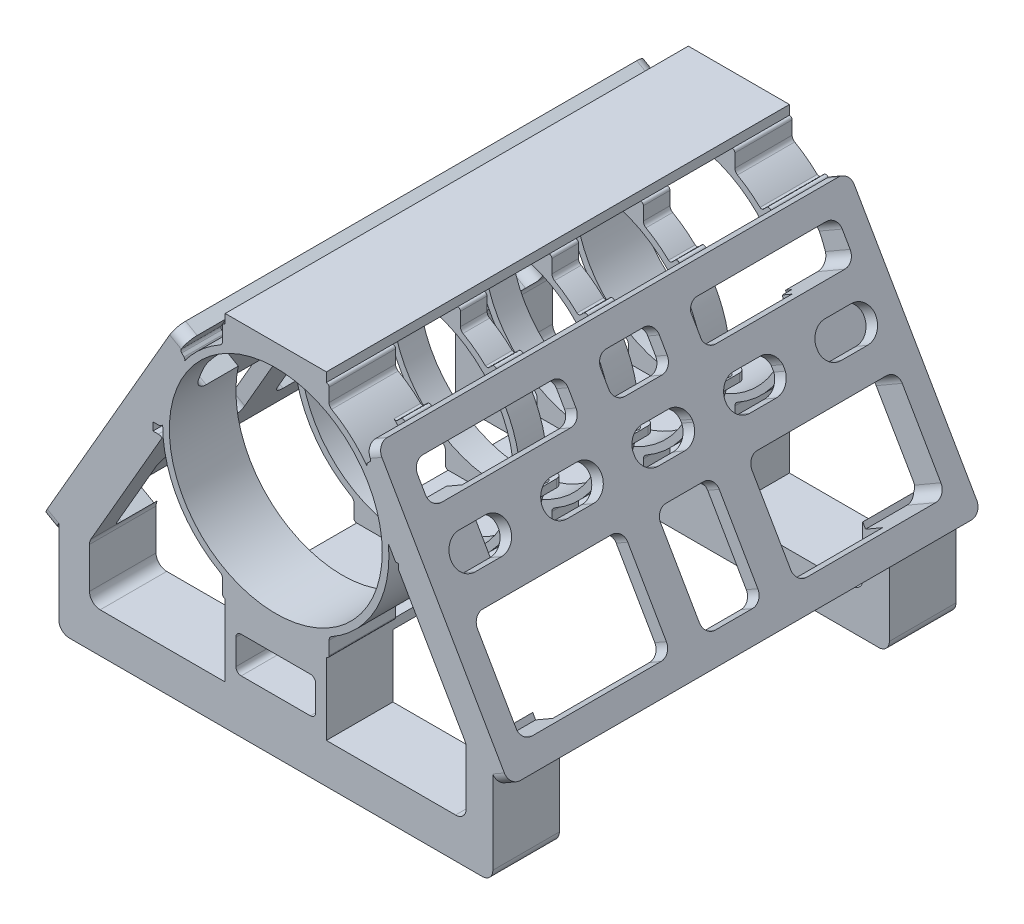
from build123d import *

# Parameters (mm, degrees)
SKETCH1_R               = 50.8
BOSS_EXTRUDE1_DEPTH     = 12.7
SKETCH2_R               = 1.905
CUT_EXTRUDE1_DEPTH      = 12.7
SKETCH4_R               = 50.8
BOSS_EXTRUDE3_DEPTH     = 12.7
SKETCH5_R               = 50.8
BOSS_EXTRUDE4_DEPTH     = 12.7
SKETCH6_R               = 50.8
BOSS_EXTRUDE5_DEPTH     = 12.7
SKETCH7_R               = 50.8
BOSS_EXTRUDE6_DEPTH     = 12.7
SKETCH8_R               = 1.905
CUT_EXTRUDE2_DEPTH      = 12.7
CUT_EXTRUDE3_DEPTH      = 12.7
SKETCH12_W              = 48.26
SKETCH12_H              = 187.2996
BOSS_EXTRUDE7_DEPTH     = 4.445
BOSS_EXTRUDE26_DEPTH    = 6.35
CUT_EXTRUDE4_DEPTH      = 6.35
BOSS_EXTRUDE28_DEPTH    = 12.7
BOSS_EXTRUDE29_DEPTH    = 12.7
BOSS_EXTRUDE30_DEPTH    = 12.7
BOSS_EXTRUDE31_DEPTH    = 12.7
SKETCH22_W              = 48.26
SKETCH22_H              = 187.2996
BOSS_EXTRUDE34_DEPTH    = 4.445
BOSS_EXTRUDE35_DEPTH    = 31.75
LPATTERN1_COUNT         = 2
LPATTERN1_PITCH         = 189.2046
BOSS_EXTRUDE36_START    = 19.05
SKETCH25_R              = 50.8
BOSS_EXTRUDE36_DEPTH    = 19.05
BOSS_EXTRUDE38_START    = 19.05
BOSS_EXTRUDE38_DEPTH    = 19.05
BOSS_EXTRUDE39_START    = 19.05
BOSS_EXTRUDE39_DEPTH    = 19.05
BOSS_EXTRUDE40_DEPTH    = 19.05
SKETCH32_R              = 50.8
CUT_EXTRUDE5_DEPTH      = 275.572714835
CUT_EXTRUDE7_DEPTH      = 275.572714835
CUT_EXTRUDE7_DEPTH_BACK = 4.445
CUT_EXTRUDE11_START     = -15.748
CUT_EXTRUDE11_DEPTH     = 9.398
CUT_EXTRUDE12_START     = -19.05
CUT_EXTRUDE12_OUTLINE_W = 12.7
CUT_EXTRUDE12_OUTLINE_H = 17.667421193
CUT_EXTRUDE12_DEPTH     = 9.632250328


# Read off the part's stored shape, not the designer's step: Cut-Extrude11, Cut-Extrude12
with BuildPart() as part:
    # Sketch1 → Boss-Extrude1 (new body)
    with BuildSketch(Plane.XY):
        with BuildLine():
            ThreePointArc((-24.13, 56.74467868), (-25.028025612, 56.372704292), (-25.4, 55.47467868))
            Line((-25.4, 55.47467868), (-25.4, 49.12467868))
            ThreePointArc((-25.4, 49.12467868), (-25.730999026, 47.870918456), (-26.637728109, 46.9439247))
            ThreePointArc((-26.637728109, 46.9439247), (-26.68425638, 46.916804598), (-26.731349183, 46.890677068))
            ThreePointArc((-26.731349183, 46.890677068), (-32.303638997, 43.240901153), (-37.383925434, 38.932540941))
            ThreePointArc((-37.383925434, 38.932540941), (-38.2373613, 38.678752562), (-39.047695886, 39.047695886))
            Line((-39.047695886, 39.047695886), (-40.5878612, 40.5878612))
            ThreePointArc((-40.5878612, 40.5878612), (-41.651655076, 40.948970562), (-42.585739075, 40.324835588))
            Line((-42.585739075, 40.324835588), (-45.080938326, 36.00302371))
            ThreePointArc((-45.080938326, 36.00302371), (-45.240221037, 35.202255446), (-44.879111675, 34.469998098))
            Line((-44.879111675, 34.469998098), (-43.788893028, 33.379779451))
            ThreePointArc((-43.788893028, 33.379779451), (-43.419949704, 32.569444865), (-43.673738083, 31.716008999))
            ThreePointArc((-43.673738083, 31.716008999), (-51.295032598, 16.796435806), (-53.974380344, 0.258633957))
            ThreePointArc((-53.974380344, 0.258633957), (-54.882706609, -0.539859536), (-56.057333721, -0.827782462))
            Line((-56.057333721, -0.827782462), (-61.157902992, -0.827782462))
            Line((-61.157902992, -0.827782462), (-61.157902992, -4.637782462))
            Line((-61.157902992, -4.637782462), (-56.057333721, -4.637782462))
            ThreePointArc((-56.057333721, -4.637782462), (-54.379209216, -5.271084231), (-53.537902992, -6.855185497))
            ThreePointArc((-53.537902992, -6.855185497), (0, -53.975), (53.537902992, -6.855185497))
            ThreePointArc((53.537902992, -6.855185497), (54.379209216, -5.271084231), (56.057333721, -4.637782462))
            Line((56.057333721, -4.637782462), (61.157902992, -4.637782462))
            Line((61.157902992, -4.637782462), (61.157902992, -0.827782462))
            Line((61.157902992, -0.827782462), (56.057333721, -0.827782462))
            ThreePointArc((56.057333721, -0.827782462), (54.882706609, -0.539859536), (53.974380344, 0.258633957))
            ThreePointArc((53.974380344, 0.258633957), (51.295032598, 16.796435806), (43.673738083, 31.716008999))
            ThreePointArc((43.673738083, 31.716008999), (43.419949704, 32.569444865), (43.788893028, 33.379779451))
            Line((43.788893028, 33.379779451), (44.879111675, 34.469998098))
            ThreePointArc((44.879111675, 34.469998098), (45.240221037, 35.202255446), (45.080938326, 36.00302371))
            Line((45.080938326, 36.00302371), (42.585739075, 40.324835588))
            ThreePointArc((42.585739075, 40.324835588), (41.651655076, 40.948970562), (40.5878612, 40.5878612))
            Line((40.5878612, 40.5878612), (39.047695886, 39.047695886))
            ThreePointArc((39.047695886, 39.047695886), (38.2373613, 38.678752562), (37.383925434, 38.932540941))
            ThreePointArc((37.383925434, 38.932540941), (32.260480437, 43.273109745), (26.637728109, 46.9439247))
            ThreePointArc((26.637728109, 46.9439247), (25.730999026, 47.870918456), (25.4, 49.12467868))
            Line((25.4, 49.12467868), (25.4, 55.47467868))
            ThreePointArc((25.4, 55.47467868), (25.028025612, 56.372704292), (24.13, 56.74467868))
            Line((24.13, 56.74467868), (-24.13, 56.74467868))
        make_face()
        Circle(SKETCH1_R, mode=Mode.SUBTRACT)
    extrude(amount=-BOSS_EXTRUDE1_DEPTH)

    # Sketch2 → Cut-Extrude1 (cut)
    with BuildSketch(Plane(origin=(0, -0.827782462, 0), x_dir=(1, 0, 0), z_dir=(0, 1, 0))):
        with Locations(Location((-58.607618357, 6.35, 0), (0, 0, 180))):
            Circle(SKETCH2_R)
        with Locations(Location((58.607618357, 6.35, 0), (0, 0, 180))):
            Circle(SKETCH2_R)
    extrude(amount=-CUT_EXTRUDE1_DEPTH, mode=Mode.SUBTRACT)


with BuildPart() as body_2:
    # Sketch4 → Boss-Extrude3 (new body)
    with BuildSketch(Plane.XY.offset(-43.6499)):
        with BuildLine():
            ThreePointArc((-24.13, 56.74467868), (-25.028025612, 56.372704292), (-25.4, 55.47467868))
            Line((-25.4, 55.47467868), (-25.4, 49.12467868))
            ThreePointArc((-25.4, 49.12467868), (-25.730999026, 47.870918456), (-26.637728109, 46.9439247))
            ThreePointArc((-26.637728109, 46.9439247), (-26.68425638, 46.916804598), (-26.731349183, 46.890677068))
            ThreePointArc((-26.731349183, 46.890677068), (-32.303638997, 43.240901153), (-37.383925434, 38.932540941))
            ThreePointArc((-37.383925434, 38.932540941), (-38.2373613, 38.678752562), (-39.047695886, 39.047695886))
            Line((-39.047695886, 39.047695886), (-40.5878612, 40.5878612))
            ThreePointArc((-40.5878612, 40.5878612), (-41.651655076, 40.948970562), (-42.585739075, 40.324835588))
            Line((-42.585739075, 40.324835588), (-45.080938326, 36.00302371))
            ThreePointArc((-45.080938326, 36.00302371), (-45.240221037, 35.202255446), (-44.879111675, 34.469998098))
            Line((-44.879111675, 34.469998098), (-43.788893028, 33.379779451))
            ThreePointArc((-43.788893028, 33.379779451), (-43.419949704, 32.569444865), (-43.673738083, 31.716008999))
            ThreePointArc((-43.673738083, 31.716008999), (-51.295032598, 16.796435806), (-53.974380344, 0.258633957))
            ThreePointArc((-53.974380344, 0.258633957), (-54.882706609, -0.539859536), (-56.057333721, -0.827782462))
            Line((-56.057333721, -0.827782462), (-61.157902992, -0.827782462))
            Line((-61.157902992, -0.827782462), (-61.157902992, -4.637782462))
            Line((-61.157902992, -4.637782462), (-56.057333721, -4.637782462))
            ThreePointArc((-56.057333721, -4.637782462), (-54.379209216, -5.271084231), (-53.537902992, -6.855185497))
            ThreePointArc((-53.537902992, -6.855185497), (0, -53.975), (53.537902992, -6.855185497))
            ThreePointArc((53.537902992, -6.855185497), (54.379209216, -5.271084231), (56.057333721, -4.637782462))
            Line((56.057333721, -4.637782462), (61.157902992, -4.637782462))
            Line((61.157902992, -4.637782462), (61.157902992, -0.827782462))
            Line((61.157902992, -0.827782462), (56.057333721, -0.827782462))
            ThreePointArc((56.057333721, -0.827782462), (54.882706609, -0.539859536), (53.974380344, 0.258633957))
            ThreePointArc((53.974380344, 0.258633957), (51.295032598, 16.796435806), (43.673738083, 31.716008999))
            ThreePointArc((43.673738083, 31.716008999), (43.419949704, 32.569444865), (43.788893028, 33.379779451))
            Line((43.788893028, 33.379779451), (44.879111675, 34.469998098))
            ThreePointArc((44.879111675, 34.469998098), (45.240221037, 35.202255446), (45.080938326, 36.00302371))
            Line((45.080938326, 36.00302371), (42.585739075, 40.324835588))
            ThreePointArc((42.585739075, 40.324835588), (41.651655076, 40.948970562), (40.5878612, 40.5878612))
            Line((40.5878612, 40.5878612), (39.047695886, 39.047695886))
            ThreePointArc((39.047695886, 39.047695886), (38.2373613, 38.678752562), (37.383925434, 38.932540941))
            ThreePointArc((37.383925434, 38.932540941), (32.260480437, 43.273109745), (26.637728109, 46.9439247))
            ThreePointArc((26.637728109, 46.9439247), (25.730999026, 47.870918456), (25.4, 49.12467868))
            Line((25.4, 49.12467868), (25.4, 55.47467868))
            ThreePointArc((25.4, 55.47467868), (25.028025612, 56.372704292), (24.13, 56.74467868))
            Line((24.13, 56.74467868), (-24.13, 56.74467868))
        make_face()
        Circle(SKETCH4_R, mode=Mode.SUBTRACT)
    extrude(amount=-BOSS_EXTRUDE3_DEPTH)


with BuildPart() as body_3:
    # Sketch5 → Boss-Extrude4 (new body)
    with BuildSketch(Plane.XY.offset(-87.2998)):
        with BuildLine():
            ThreePointArc((-24.13, 56.74467868), (-25.028025612, 56.372704292), (-25.4, 55.47467868))
            Line((-25.4, 55.47467868), (-25.4, 49.12467868))
            ThreePointArc((-25.4, 49.12467868), (-25.730999026, 47.870918456), (-26.637728109, 46.9439247))
            ThreePointArc((-26.637728109, 46.9439247), (-26.68425638, 46.916804598), (-26.731349183, 46.890677068))
            ThreePointArc((-26.731349183, 46.890677068), (-32.303638997, 43.240901153), (-37.383925434, 38.932540941))
            ThreePointArc((-37.383925434, 38.932540941), (-38.2373613, 38.678752562), (-39.047695886, 39.047695886))
            Line((-39.047695886, 39.047695886), (-40.5878612, 40.5878612))
            ThreePointArc((-40.5878612, 40.5878612), (-41.651655076, 40.948970562), (-42.585739075, 40.324835588))
            Line((-42.585739075, 40.324835588), (-45.080938326, 36.00302371))
            ThreePointArc((-45.080938326, 36.00302371), (-45.240221037, 35.202255446), (-44.879111675, 34.469998098))
            Line((-44.879111675, 34.469998098), (-43.788893028, 33.379779451))
            ThreePointArc((-43.788893028, 33.379779451), (-43.419949704, 32.569444865), (-43.673738083, 31.716008999))
            ThreePointArc((-43.673738083, 31.716008999), (-51.295032598, 16.796435806), (-53.974380344, 0.258633957))
            ThreePointArc((-53.974380344, 0.258633957), (-54.882706609, -0.539859536), (-56.057333721, -0.827782462))
            Line((-56.057333721, -0.827782462), (-61.157902992, -0.827782462))
            Line((-61.157902992, -0.827782462), (-61.157902992, -4.637782462))
            Line((-61.157902992, -4.637782462), (-56.057333721, -4.637782462))
            ThreePointArc((-56.057333721, -4.637782462), (-54.379209216, -5.271084231), (-53.537902992, -6.855185497))
            ThreePointArc((-53.537902992, -6.855185497), (0, -53.975), (53.537902992, -6.855185497))
            ThreePointArc((53.537902992, -6.855185497), (54.379209216, -5.271084231), (56.057333721, -4.637782462))
            Line((56.057333721, -4.637782462), (61.157902992, -4.637782462))
            Line((61.157902992, -4.637782462), (61.157902992, -0.827782462))
            Line((61.157902992, -0.827782462), (56.057333721, -0.827782462))
            ThreePointArc((56.057333721, -0.827782462), (54.882706609, -0.539859536), (53.974380344, 0.258633957))
            ThreePointArc((53.974380344, 0.258633957), (51.295032598, 16.796435806), (43.673738083, 31.716008999))
            ThreePointArc((43.673738083, 31.716008999), (43.419949704, 32.569444865), (43.788893028, 33.379779451))
            Line((43.788893028, 33.379779451), (44.879111675, 34.469998098))
            ThreePointArc((44.879111675, 34.469998098), (45.240221037, 35.202255446), (45.080938326, 36.00302371))
            Line((45.080938326, 36.00302371), (42.585739075, 40.324835588))
            ThreePointArc((42.585739075, 40.324835588), (41.651655076, 40.948970562), (40.5878612, 40.5878612))
            Line((40.5878612, 40.5878612), (39.047695886, 39.047695886))
            ThreePointArc((39.047695886, 39.047695886), (38.2373613, 38.678752562), (37.383925434, 38.932540941))
            ThreePointArc((37.383925434, 38.932540941), (32.260480437, 43.273109745), (26.637728109, 46.9439247))
            ThreePointArc((26.637728109, 46.9439247), (25.730999026, 47.870918456), (25.4, 49.12467868))
            Line((25.4, 49.12467868), (25.4, 55.47467868))
            ThreePointArc((25.4, 55.47467868), (25.028025612, 56.372704292), (24.13, 56.74467868))
            Line((24.13, 56.74467868), (-24.13, 56.74467868))
        make_face()
        Circle(SKETCH5_R, mode=Mode.SUBTRACT)
    extrude(amount=-BOSS_EXTRUDE4_DEPTH)


with BuildPart() as body_4:
    # Sketch6 → Boss-Extrude5 (new body)
    with BuildSketch(Plane.XY.offset(-130.9497)):
        with BuildLine():
            ThreePointArc((-24.13, 56.74467868), (-25.028025612, 56.372704292), (-25.4, 55.47467868))
            Line((-25.4, 55.47467868), (-25.4, 49.12467868))
            ThreePointArc((-25.4, 49.12467868), (-25.730999026, 47.870918456), (-26.637728109, 46.9439247))
            ThreePointArc((-26.637728109, 46.9439247), (-26.68425638, 46.916804598), (-26.731349183, 46.890677068))
            ThreePointArc((-26.731349183, 46.890677068), (-32.303638997, 43.240901153), (-37.383925434, 38.932540941))
            ThreePointArc((-37.383925434, 38.932540941), (-38.2373613, 38.678752562), (-39.047695886, 39.047695886))
            Line((-39.047695886, 39.047695886), (-40.5878612, 40.5878612))
            ThreePointArc((-40.5878612, 40.5878612), (-41.651655076, 40.948970562), (-42.585739075, 40.324835588))
            Line((-42.585739075, 40.324835588), (-45.080938326, 36.00302371))
            ThreePointArc((-45.080938326, 36.00302371), (-45.240221037, 35.202255446), (-44.879111675, 34.469998098))
            Line((-44.879111675, 34.469998098), (-43.788893028, 33.379779451))
            ThreePointArc((-43.788893028, 33.379779451), (-43.419949704, 32.569444865), (-43.673738083, 31.716008999))
            ThreePointArc((-43.673738083, 31.716008999), (-51.295032598, 16.796435806), (-53.974380344, 0.258633957))
            ThreePointArc((-53.974380344, 0.258633957), (-54.882706609, -0.539859536), (-56.057333721, -0.827782462))
            Line((-56.057333721, -0.827782462), (-61.157902992, -0.827782462))
            Line((-61.157902992, -0.827782462), (-61.157902992, -4.637782462))
            Line((-61.157902992, -4.637782462), (-56.057333721, -4.637782462))
            ThreePointArc((-56.057333721, -4.637782462), (-54.379209216, -5.271084231), (-53.537902992, -6.855185497))
            ThreePointArc((-53.537902992, -6.855185497), (0, -53.975), (53.537902992, -6.855185497))
            ThreePointArc((53.537902992, -6.855185497), (54.379209216, -5.271084231), (56.057333721, -4.637782462))
            Line((56.057333721, -4.637782462), (61.157902992, -4.637782462))
            Line((61.157902992, -4.637782462), (61.157902992, -0.827782462))
            Line((61.157902992, -0.827782462), (56.057333721, -0.827782462))
            ThreePointArc((56.057333721, -0.827782462), (54.882706609, -0.539859536), (53.974380344, 0.258633957))
            ThreePointArc((53.974380344, 0.258633957), (51.295032598, 16.796435806), (43.673738083, 31.716008999))
            ThreePointArc((43.673738083, 31.716008999), (43.419949704, 32.569444865), (43.788893028, 33.379779451))
            Line((43.788893028, 33.379779451), (44.879111675, 34.469998098))
            ThreePointArc((44.879111675, 34.469998098), (45.240221037, 35.202255446), (45.080938326, 36.00302371))
            Line((45.080938326, 36.00302371), (42.585739075, 40.324835588))
            ThreePointArc((42.585739075, 40.324835588), (41.651655076, 40.948970562), (40.5878612, 40.5878612))
            Line((40.5878612, 40.5878612), (39.047695886, 39.047695886))
            ThreePointArc((39.047695886, 39.047695886), (38.2373613, 38.678752562), (37.383925434, 38.932540941))
            ThreePointArc((37.383925434, 38.932540941), (32.260480437, 43.273109745), (26.637728109, 46.9439247))
            ThreePointArc((26.637728109, 46.9439247), (25.730999026, 47.870918456), (25.4, 49.12467868))
            Line((25.4, 49.12467868), (25.4, 55.47467868))
            ThreePointArc((25.4, 55.47467868), (25.028025612, 56.372704292), (24.13, 56.74467868))
            Line((24.13, 56.74467868), (-24.13, 56.74467868))
        make_face()
        Circle(SKETCH6_R, mode=Mode.SUBTRACT)
    extrude(amount=-BOSS_EXTRUDE5_DEPTH)


with BuildPart() as body_5:
    # Sketch7 → Boss-Extrude6 (new body)
    with BuildSketch(Plane.XY.offset(-174.5996)):
        with BuildLine():
            ThreePointArc((-24.13, 56.74467868), (-25.028025612, 56.372704292), (-25.4, 55.47467868))
            Line((-25.4, 55.47467868), (-25.4, 49.12467868))
            ThreePointArc((-25.4, 49.12467868), (-25.75807733, 47.824365847), (-26.731349183, 46.890677068))
            ThreePointArc((-26.731349183, 46.890677068), (-32.303638997, 43.240901153), (-37.383925434, 38.932540941))
            ThreePointArc((-37.383925434, 38.932540941), (-38.2373613, 38.678752562), (-39.047695886, 39.047695886))
            Line((-39.047695886, 39.047695886), (-40.5878612, 40.5878612))
            ThreePointArc((-40.5878612, 40.5878612), (-41.651655076, 40.948970562), (-42.585739075, 40.324835588))
            Line((-42.585739075, 40.324835588), (-45.080938326, 36.00302371))
            ThreePointArc((-45.080938326, 36.00302371), (-45.240221037, 35.202255446), (-44.879111675, 34.469998098))
            Line((-44.879111675, 34.469998098), (-43.788893028, 33.379779451))
            ThreePointArc((-43.788893028, 33.379779451), (-43.419949704, 32.569444865), (-43.673738083, 31.716008999))
            ThreePointArc((-43.673738083, 31.716008999), (-51.295032598, 16.796435806), (-53.974380344, 0.258633957))
            ThreePointArc((-53.974380344, 0.258633957), (-54.882706609, -0.539859536), (-56.057333721, -0.827782462))
            Line((-56.057333721, -0.827782462), (-61.157902992, -0.827782462))
            Line((-61.157902992, -0.827782462), (-61.157902992, -4.637782462))
            Line((-61.157902992, -4.637782462), (-56.057333721, -4.637782462))
            ThreePointArc((-56.057333721, -4.637782462), (-54.379209216, -5.271084231), (-53.537902992, -6.855185497))
            ThreePointArc((-53.537902992, -6.855185497), (-44.849730852, -30.030022769), (-26.731349183, -46.890677068))
            ThreePointArc((-26.731349183, -46.890677068), (-25.75807733, -47.824365847), (-25.4, -49.12467868))
            Line((-25.4, -49.12467868), (-25.4, -55.47467868))
            ThreePointArc((-25.4, -55.47467868), (-25.028025612, -56.372704292), (-24.13, -56.74467868))
            Line((-24.13, -56.74467868), (24.13, -56.74467868))
            ThreePointArc((24.13, -56.74467868), (25.028025612, -56.372704292), (25.4, -55.47467868))
            Line((25.4, -55.47467868), (25.4, -49.12467868))
            ThreePointArc((25.4, -49.12467868), (25.730999026, -47.870918456), (26.637728109, -46.9439247))
            ThreePointArc((26.637728109, -46.9439247), (44.819746857, -30.074755472), (53.537902992, -6.855185497))
            ThreePointArc((53.537902992, -6.855185497), (54.379209216, -5.271084231), (56.057333721, -4.637782462))
            Line((56.057333721, -4.637782462), (61.157902992, -4.637782462))
            Line((61.157902992, -4.637782462), (61.157902992, -0.827782462))
            Line((61.157902992, -0.827782462), (56.057333721, -0.827782462))
            ThreePointArc((56.057333721, -0.827782462), (54.882706609, -0.539859536), (53.974380344, 0.258633957))
            ThreePointArc((53.974380344, 0.258633957), (51.295032598, 16.796435806), (43.673738083, 31.716008999))
            ThreePointArc((43.673738083, 31.716008999), (43.419949704, 32.569444865), (43.788893028, 33.379779451))
            Line((43.788893028, 33.379779451), (44.879111675, 34.469998098))
            ThreePointArc((44.879111675, 34.469998098), (45.240221037, 35.202255446), (45.080938326, 36.00302371))
            Line((45.080938326, 36.00302371), (42.585739075, 40.324835588))
            ThreePointArc((42.585739075, 40.324835588), (41.651655076, 40.948970562), (40.5878612, 40.5878612))
            Line((40.5878612, 40.5878612), (39.047695886, 39.047695886))
            ThreePointArc((39.047695886, 39.047695886), (38.2373613, 38.678752562), (37.383925434, 38.932540941))
            ThreePointArc((37.383925434, 38.932540941), (32.260480437, 43.273109745), (26.637728109, 46.9439247))
            ThreePointArc((26.637728109, 46.9439247), (25.730999026, 47.870918456), (25.4, 49.12467868))
            Line((25.4, 49.12467868), (25.4, 55.47467868))
            ThreePointArc((25.4, 55.47467868), (25.028025612, 56.372704292), (24.13, 56.74467868))
            Line((24.13, 56.74467868), (-24.13, 56.74467868))
        make_face()
        Circle(SKETCH7_R, mode=Mode.SUBTRACT)
    extrude(amount=-BOSS_EXTRUDE6_DEPTH)


with BuildPart() as cut_extrude2_tool:
    # Sketch8 → Cut-Extrude2 (new body)
    with BuildSketch(Plane(origin=(0, -0.827782462, 0), x_dir=(1, 0, 0), z_dir=(0, 1, 0))):
        with Locations(Location((-58.607618357, 49.9999, 0), (0, 0, 180))):
            Circle(SKETCH8_R)
        with Locations(Location((58.607618357, 49.9999, 0), (0, 0, 180))):
            Circle(SKETCH8_R)
        with Locations(Location((58.607618357, 93.6498, 0), (0, 0, 180))):
            Circle(SKETCH8_R)
        with Locations(Location((-58.607618357, 93.6498, 0), (0, 0, 180))):
            Circle(SKETCH8_R)
        with Locations(Location((58.607618357, 137.2997, 0), (0, 0, 180))):
            Circle(SKETCH8_R)
        with Locations(Location((-58.607618357, 137.2997, 0), (0, 0, 180))):
            Circle(SKETCH8_R)
        with Locations(Location((58.607618357, 180.9496, 0), (0, 0, 180))):
            Circle(SKETCH8_R)
        with Locations(Location((-58.607618357, 180.9496, 0), (0, 0, 180))):
            Circle(SKETCH8_R)
    extrude(amount=-CUT_EXTRUDE2_DEPTH)


with BuildPart() as body_2_1:
    add(body_2.part)

    # Cut-Extrude2: cut by cut_extrude2_tool
    add(cut_extrude2_tool.part, mode=Mode.SUBTRACT)


with BuildPart() as body_3_1:
    add(body_3.part)

    # Cut-Extrude2: cut by cut_extrude2_tool
    add(cut_extrude2_tool.part, mode=Mode.SUBTRACT)


with BuildPart() as body_4_1:
    add(body_4.part)

    # Cut-Extrude2: cut by cut_extrude2_tool
    add(cut_extrude2_tool.part, mode=Mode.SUBTRACT)


with BuildPart() as body_5_1:
    add(body_5.part)

    # Cut-Extrude2: cut by cut_extrude2_tool
    add(cut_extrude2_tool.part, mode=Mode.SUBTRACT)


with BuildPart() as cut_extrude3_tool:
    # Sketch11 → Cut-Extrude3 (new body)
    with BuildSketch(Plane(origin=(0, -0.827782462, 0), x_dir=(1, 0, 0), z_dir=(0, 1, 0))):
        with BuildLine():
            Line((-58.617902992, 0), (-61.157902992, 0))
            Line((-61.157902992, 0), (-61.157902992, 2.54))
            ThreePointArc((-61.157902992, 2.54), (-60.413954216, 0.743948776), (-58.617902992, 0))
        make_face()
        with BuildLine():
            Line((-58.617902992, 12.7), (-61.157902992, 12.7))
            Line((-61.157902992, 12.7), (-61.157902992, 10.16))
            ThreePointArc((-61.157902992, 10.16), (-60.413954216, 11.956051224), (-58.617902992, 12.7))
        make_face()
        with BuildLine():
            Line((58.617902992, 12.7), (61.157902992, 12.7))
            Line((61.157902992, 12.7), (61.157902992, 10.16))
            ThreePointArc((61.157902992, 10.16), (60.413954216, 11.956051224), (58.617902992, 12.7))
        make_face()
        with BuildLine():
            Line((61.157902992, 0), (61.157902992, 2.54))
            ThreePointArc((61.157902992, 2.54), (60.413954216, 0.743948776), (58.617902992, 0))
            Line((58.617902992, 0), (61.157902992, 0))
        make_face()
        with BuildLine():
            Line((58.617902992, 43.6499), (61.157902992, 43.6499))
            Line((61.157902992, 43.6499), (61.157902992, 46.1899))
            ThreePointArc((61.157902992, 46.1899), (60.413954216, 44.393848776), (58.617902992, 43.6499))
        make_face()
        with BuildLine():
            Line((58.617902992, 56.3499), (61.157902992, 56.3499))
            Line((61.157902992, 56.3499), (61.157902992, 53.8099))
            ThreePointArc((61.157902992, 53.8099), (60.413954216, 55.605951224), (58.617902992, 56.3499))
        make_face()
        with BuildLine():
            Line((58.617902992, 87.2998), (61.157902992, 87.2998))
            Line((61.157902992, 87.2998), (61.157902992, 89.8398))
            ThreePointArc((61.157902992, 89.8398), (60.413954216, 88.043748776), (58.617902992, 87.2998))
        make_face()
        with BuildLine():
            Line((61.157902992, 99.9998), (61.157902992, 97.4598))
            ThreePointArc((61.157902992, 97.4598), (60.413954216, 99.255851224), (58.617902992, 99.9998))
            Line((58.617902992, 99.9998), (61.157902992, 99.9998))
        make_face()
        with BuildLine():
            Line((61.157902992, 130.9497), (61.157902992, 133.4897))
            ThreePointArc((61.157902992, 133.4897), (60.413954216, 131.693648776), (58.617902992, 130.9497))
            Line((58.617902992, 130.9497), (61.157902992, 130.9497))
        make_face()
        with BuildLine():
            Line((61.157902992, 143.6497), (61.157902992, 141.1097))
            ThreePointArc((61.157902992, 141.1097), (60.413954216, 142.905751224), (58.617902992, 143.6497))
            Line((58.617902992, 143.6497), (61.157902992, 143.6497))
        make_face()
        with BuildLine():
            Line((58.617902992, 174.5996), (61.157902992, 174.5996))
            Line((61.157902992, 174.5996), (61.157902992, 177.1396))
            ThreePointArc((61.157902992, 177.1396), (60.413954216, 175.343548776), (58.617902992, 174.5996))
        make_face()
        with BuildLine():
            Line((61.157902992, 187.2996), (58.617902992, 187.2996))
            ThreePointArc((58.617902992, 187.2996), (60.413954216, 186.555651224), (61.157902992, 184.7596))
            Line((61.157902992, 184.7596), (61.157902992, 187.2996))
        make_face()
        with BuildLine():
            Line((-61.157902992, 56.3499), (-61.157902992, 53.8099))
            ThreePointArc((-61.157902992, 53.8099), (-60.413954216, 55.605951224), (-58.617902992, 56.3499))
            Line((-58.617902992, 56.3499), (-61.157902992, 56.3499))
        make_face()
        with BuildLine():
            Line((-61.157902992, 43.6499), (-61.157902992, 46.1899))
            ThreePointArc((-61.157902992, 46.1899), (-60.413954216, 44.393848776), (-58.617902992, 43.6499))
            Line((-58.617902992, 43.6499), (-61.157902992, 43.6499))
        make_face()
        with BuildLine():
            Line((-61.157902992, 187.2996), (-61.157902992, 184.7596))
            ThreePointArc((-61.157902992, 184.7596), (-60.413954216, 186.555651224), (-58.617902992, 187.2996))
            Line((-58.617902992, 187.2996), (-61.157902992, 187.2996))
        make_face()
        with BuildLine():
            Line((-61.157902992, 174.5996), (-61.157902992, 177.1396))
            ThreePointArc((-61.157902992, 177.1396), (-60.413954216, 175.343548776), (-58.617902992, 174.5996))
            Line((-58.617902992, 174.5996), (-61.157902992, 174.5996))
        make_face()
        with BuildLine():
            Line((-61.157902992, 130.9497), (-58.617902992, 130.9497))
            ThreePointArc((-58.617902992, 130.9497), (-60.413954216, 131.693648776), (-61.157902992, 133.4897))
            Line((-61.157902992, 133.4897), (-61.157902992, 130.9497))
        make_face()
        with BuildLine():
            Line((-58.617902992, 143.6497), (-61.157902992, 143.6497))
            Line((-61.157902992, 143.6497), (-61.157902992, 141.1097))
            ThreePointArc((-61.157902992, 141.1097), (-60.413954216, 142.905751224), (-58.617902992, 143.6497))
        make_face()
        with BuildLine():
            Line((-58.617902992, 99.9998), (-61.157902992, 99.9998))
            Line((-61.157902992, 99.9998), (-61.157902992, 97.4598))
            ThreePointArc((-61.157902992, 97.4598), (-60.413954216, 99.255851224), (-58.617902992, 99.9998))
        make_face()
        with BuildLine():
            Line((-61.157902992, 87.2998), (-61.157902992, 89.8398))
            ThreePointArc((-61.157902992, 89.8398), (-60.413954216, 88.043748776), (-58.617902992, 87.2998))
            Line((-58.617902992, 87.2998), (-61.157902992, 87.2998))
        make_face()
    extrude(amount=-CUT_EXTRUDE3_DEPTH)


with BuildPart() as part_1:
    add(part.part)

    # Cut-Extrude3: cut by cut_extrude3_tool
    add(cut_extrude3_tool.part, mode=Mode.SUBTRACT)



with BuildPart() as body_2_2:
    add(body_2_1.part)

    # Cut-Extrude3: cut by cut_extrude3_tool
    add(cut_extrude3_tool.part, mode=Mode.SUBTRACT)


with BuildPart() as body_3_2:
    add(body_3_1.part)

    # Cut-Extrude3: cut by cut_extrude3_tool
    add(cut_extrude3_tool.part, mode=Mode.SUBTRACT)


with BuildPart() as body_4_2:
    add(body_4_1.part)

    # Cut-Extrude3: cut by cut_extrude3_tool
    add(cut_extrude3_tool.part, mode=Mode.SUBTRACT)


with BuildPart() as body_5_2:
    add(body_5_1.part)

    # Cut-Extrude3: cut by cut_extrude3_tool
    add(cut_extrude3_tool.part, mode=Mode.SUBTRACT)


with BuildPart() as part_2:
    add(part_1.part)

    add(body_2_2.part)  # Boss-Extrude7 merges body 2

    add(body_3_2.part)  # Boss-Extrude7 merges body 3

    add(body_4_2.part)  # Boss-Extrude7 merges body 4

    add(body_5_2.part)  # Boss-Extrude7 merges body 5
    # Sketch12 → Boss-Extrude7 (add)
    with BuildSketch(Plane(origin=(0, 56.74467868, 0), x_dir=(1, 0, 0), z_dir=(0, 1, 0))):
        with Locations((0, 93.6498)):
            Rectangle(SKETCH12_W, SKETCH12_H)
    extrude(amount=BOSS_EXTRUDE7_DEPTH)

    # Sketch14 → Boss-Extrude26 (add)
    with BuildSketch(Plane(origin=(49.400470317, 28.521374836, 0), x_dir=(0, 0, -1), z_dir=(0.8660254037844382, 0.500000000000001, 0))):
        with BuildLine():
            Line((-13.97, -113.370537515), (201.2696, -113.370537515))
            ThreePointArc((201.2696, -113.370537515), (204.861702448, -111.882639963), (206.3496, -108.290537515))
            Line((206.3496, -108.290537515), (206.3496, 8.549462485))
            ThreePointArc((206.3496, 8.549462485), (204.861702448, 12.141564933), (201.2696, 13.629462485))
            Line((201.2696, 13.629462485), (-13.97, 13.629462485))
            ThreePointArc((-13.97, 13.629462485), (-17.562102448, 12.141564933), (-19.05, 8.549462485))
            Line((-19.05, 8.549462485), (-19.05, -108.290537515))
            ThreePointArc((-19.05, -108.290537515), (-17.562102448, -111.882639963), (-13.97, -113.370537515))
        make_face()
    boss_extrude26 = extrude(amount=BOSS_EXTRUDE26_DEPTH)

    # Sketch15 → Cut-Extrude4 (cut)
    with BuildSketch(Plane(origin=(54.899731631, 31.696374836, 0), x_dir=(0, 0, -1), z_dir=(0.8660254037844383, 0.5000000000000009, 0))):
        with BuildLine():
            Line((189.895999914, -54.858029741), (128.353549518, -54.917164495))
            ThreePointArc((128.353549518, -54.917164495), (124.762878414, -56.408512928), (123.278433118, -60.002043405))
            Line((123.278433118, -60.002043405), (123.313822219, -96.832026403))
            ThreePointArc((123.313822219, -96.832026403), (124.805170652, -100.422697506), (128.398701129, -101.907142802))
            Line((128.398701129, -101.907142802), (189.941151525, -101.848008049))
            ThreePointArc((189.941151525, -101.848008049), (193.531822629, -100.356659616), (195.016267925, -96.763129139))
            Line((195.016267925, -96.763129139), (194.980878824, -59.933146141))
            ThreePointArc((194.980878824, -59.933146141), (193.489530391, -56.342475037), (189.895999914, -54.858029741))
        make_face()
        with BuildLine():
            Line((63.9699, -96.860537515), (63.9699, -60.030537515))
            ThreePointArc((63.9699, -60.030537515), (62.482002448, -56.438435067), (58.8899, -54.950537515))
            Line((58.8899, -54.950537515), (-2.652578807, -54.950537515))
            ThreePointArc((-2.652578807, -54.950537515), (-6.244681255, -56.438435067), (-7.732578807, -60.030537515))
            Line((-7.732578807, -60.030537515), (-7.732578807, -96.860537515))
            ThreePointArc((-7.732578807, -96.860537515), (-6.244681255, -100.452639963), (-2.652578807, -101.940537515))
            Line((-2.652578807, -101.940537515), (58.8899, -101.940537515))
            ThreePointArc((58.8899, -101.940537515), (62.482002448, -100.452639963), (63.9699, -96.860537515))
        make_face()
        with BuildLine():
            ThreePointArc((84.7598, 2.199462485), (81.167697552, 0.711564933), (79.6798, -2.880537515))
            Line((79.6798, -2.880537515), (79.6798, -10.359593345))
            ThreePointArc((79.6798, -10.359593345), (81.167697552, -13.951695793), (84.7598, -15.439593345))
            Line((84.7598, -15.439593345), (102.5398, -15.439593345))
            ThreePointArc((102.5398, -15.439593345), (106.131902448, -13.951695793), (107.6198, -10.359593345))
            Line((107.6198, -10.359593345), (107.6198, -2.880537515))
            ThreePointArc((107.6198, -2.880537515), (106.131902448, 0.711564933), (102.5398, 2.199462485))
            Line((102.5398, 2.199462485), (84.7598, 2.199462485))
        make_face()
        with BuildLine():
            Line((79.6798, -33.427745376), (79.6798, -35.833329654))
            ThreePointArc((79.6798, -35.833329654), (82.293715408, -40.508184153), (87.318259667, -42.363116322))
            Line((87.318259667, -42.363116322), (99.90568086, -42.363116322))
            ThreePointArc((99.90568086, -42.363116322), (105.181270272, -40.283937497), (107.6198, -35.16452337))
            Line((107.6198, -35.16452337), (107.6198, -34.09655166))
            ThreePointArc((107.6198, -34.09655166), (105.181270272, -28.977137533), (99.90568086, -26.897958708))
            Line((99.90568086, -26.897958708), (87.318259667, -26.897958708))
            ThreePointArc((87.318259667, -26.897958708), (82.293715408, -28.752890877), (79.6798, -33.427745376))
        make_face()
        with BuildLine():
            ThreePointArc((174.618059667, -26.897958708), (169.593515408, -28.752890877), (166.9796, -33.427745376))
            Line((166.9796, -33.427745376), (166.9796, -35.833329654))
            ThreePointArc((166.9796, -35.833329654), (169.593515408, -40.508184153), (174.618059667, -42.363116322))
            Line((174.618059667, -42.363116322), (187.20548086, -42.363116322))
            ThreePointArc((187.20548086, -42.363116322), (194.938059667, -34.630537515), (187.20548086, -26.897958708))
            Line((187.20548086, -26.897958708), (174.618059667, -26.897958708))
        make_face()
        with BuildLine():
            Line((123.3297, -1.372587884), (123.3297, -11.805431143))
            ThreePointArc((123.3297, -11.805431143), (125.163930258, -14.42901202), (128.20303286, -15.434712089))
            Line((128.20303286, -15.434712089), (189.858062012, -15.375469161))
            ThreePointArc((189.858062012, -15.375469161), (193.448733115, -13.884120728), (194.933178411, -10.290590251))
            Line((194.933178411, -10.290590251), (194.925964703, -2.783172524))
            ThreePointArc((194.925964703, -2.783172524), (193.434616269, 0.80749858), (189.841085793, 2.291943876))
            Line((189.841085793, 2.291943876), (128.186056641, 2.232700948))
            ThreePointArc((128.186056641, 2.232700948), (125.162851737, 1.231562718), (123.3297, -1.372587884))
        make_face()
        with BuildLine():
            ThreePointArc((143.631240333, -42.363116322), (148.655784592, -40.508184153), (151.2697, -35.833329654))
            Line((151.2697, -35.833329654), (151.2697, -33.427745376))
            ThreePointArc((151.2697, -33.427745376), (148.655784592, -28.752890877), (143.631240333, -26.897958708))
            Line((143.631240333, -26.897958708), (131.04381914, -26.897958708))
            ThreePointArc((131.04381914, -26.897958708), (125.768229728, -28.977137533), (123.3297, -34.09655166))
            Line((123.3297, -34.09655166), (123.3297, -35.16452337))
            ThreePointArc((123.3297, -35.16452337), (125.768229728, -40.283937497), (131.04381914, -42.363116322))
            Line((131.04381914, -42.363116322), (143.631240333, -42.363116322))
        make_face()
        with BuildLine():
            Line((-2.652578807, -15.467958708), (59.002478807, -15.467958708))
            ThreePointArc((59.002478807, -15.467958708), (62.594581255, -13.980061156), (64.082478807, -10.387958708))
            Line((64.082478807, -10.387958708), (64.082478807, -2.880537515))
            ThreePointArc((64.082478807, -2.880537515), (62.594581255, 0.711564933), (59.002478807, 2.199462485))
            Line((59.002478807, 2.199462485), (-2.652578807, 2.199462485))
            ThreePointArc((-2.652578807, 2.199462485), (-6.244681255, 0.711564933), (-7.732578807, -2.880537515))
            Line((-7.732578807, -2.880537515), (-7.732578807, -10.387958708))
            ThreePointArc((-7.732578807, -10.387958708), (-6.244681255, -13.980061156), (-2.652578807, -15.467958708))
        make_face()
        with BuildLine():
            Line((12.587421193, -26.897958708), (0, -26.897958708))
            ThreePointArc((0, -26.897958708), (-7.732578807, -34.630537515), (0, -42.363116322))
            Line((0, -42.363116322), (12.587421193, -42.363116322))
            ThreePointArc((12.587421193, -42.363116322), (20.32, -34.630537515), (12.587421193, -26.897958708))
        make_face()
        with BuildLine():
            ThreePointArc((56.3499, -42.363116322), (64.082478807, -34.630537515), (56.3499, -26.897958708))
            Line((56.3499, -26.897958708), (43.762478807, -26.897958708))
            ThreePointArc((43.762478807, -26.897958708), (36.0299, -34.630537515), (43.762478807, -42.363116322))
            Line((43.762478807, -42.363116322), (56.3499, -42.363116322))
        make_face()
        with BuildLine():
            Line((107.6198, -96.827142802), (107.6198, -60.030537515))
            ThreePointArc((107.6198, -60.030537515), (106.131902448, -56.438435067), (102.5398, -54.950537515))
            Line((102.5398, -54.950537515), (84.7598, -54.950537515))
            ThreePointArc((84.7598, -54.950537515), (81.167697552, -56.438435067), (79.6798, -60.030537515))
            Line((79.6798, -60.030537515), (79.6798, -96.827142802))
            ThreePointArc((79.6798, -96.827142802), (81.167697552, -100.419245251), (84.7598, -101.907142802))
            Line((84.7598, -101.907142802), (102.5398, -101.907142802))
            ThreePointArc((102.5398, -101.907142802), (106.131902448, -100.419245251), (107.6198, -96.827142802))
        make_face()
    cut_extrude4 = extrude(amount=-CUT_EXTRUDE4_DEPTH, mode=Mode.SUBTRACT)

    # Mirror1: Boss-Extrude26, Cut-Extrude4 across plane
    add(boss_extrude26.mirror(Plane(origin=(0, 0, 0), x_dir=(0, 0, 1), z_dir=(1, 0, 0))))
    add(cut_extrude4.mirror(Plane(origin=(0, 0, 0), x_dir=(0, 0, 1), z_dir=(1, 0, 0))), mode=Mode.SUBTRACT)

    # Sketch18 → Boss-Extrude28 (add)
    with BuildSketch(Plane.XY.offset(-130.9497)):
        with BuildLine():
            ThreePointArc((26.637728109, -46.9439247), (0, -53.975), (-26.637728109, -46.9439247))
            ThreePointArc((-26.637728109, -46.9439247), (-25.730999026, -47.870918456), (-25.4, -49.12467868))
            Line((-25.4, -49.12467868), (-25.4, -55.47467868))
            ThreePointArc((-25.4, -55.47467868), (-25.028025612, -56.372704292), (-24.13, -56.74467868))
            Line((-24.13, -56.74467868), (24.13, -56.74467868))
            ThreePointArc((24.13, -56.74467868), (25.028025612, -56.372704292), (25.4, -55.47467868))
            Line((25.4, -55.47467868), (25.4, -49.12467868))
            ThreePointArc((25.4, -49.12467868), (25.730999026, -47.870918456), (26.637728109, -46.9439247))
        make_face()
    extrude(amount=-BOSS_EXTRUDE28_DEPTH)

    # Sketch19 → Boss-Extrude29 (add)
    with BuildSketch(Plane.XY.offset(-87.2998)):
        with BuildLine():
            ThreePointArc((26.637728109, -46.9439247), (0, -53.975), (-26.637728109, -46.9439247))
            ThreePointArc((-26.637728109, -46.9439247), (-25.730999026, -47.870918456), (-25.4, -49.12467868))
            Line((-25.4, -49.12467868), (-25.4, -55.47467868))
            ThreePointArc((-25.4, -55.47467868), (-25.028025612, -56.372704292), (-24.13, -56.74467868))
            Line((-24.13, -56.74467868), (24.13, -56.74467868))
            ThreePointArc((24.13, -56.74467868), (25.028025612, -56.372704292), (25.4, -55.47467868))
            Line((25.4, -55.47467868), (25.4, -49.12467868))
            ThreePointArc((25.4, -49.12467868), (25.730999026, -47.870918456), (26.637728109, -46.9439247))
        make_face()
    extrude(amount=-BOSS_EXTRUDE29_DEPTH)

    # Sketch20 → Boss-Extrude30 (add)
    with BuildSketch(Plane.XY.offset(-43.6499)):
        with BuildLine():
            ThreePointArc((26.637728109, -46.9439247), (0, -53.975), (-26.637728109, -46.9439247))
            ThreePointArc((-26.637728109, -46.9439247), (-25.730999026, -47.870918456), (-25.4, -49.12467868))
            Line((-25.4, -49.12467868), (-25.4, -55.47467868))
            ThreePointArc((-25.4, -55.47467868), (-25.028025612, -56.372704292), (-24.13, -56.74467868))
            Line((-24.13, -56.74467868), (24.13, -56.74467868))
            ThreePointArc((24.13, -56.74467868), (25.028025612, -56.372704292), (25.4, -55.47467868))
            Line((25.4, -55.47467868), (25.4, -49.12467868))
            ThreePointArc((25.4, -49.12467868), (25.730999026, -47.870918456), (26.637728109, -46.9439247))
        make_face()
    extrude(amount=-BOSS_EXTRUDE30_DEPTH)

    # Sketch21 → Boss-Extrude31 (add)
    with BuildSketch(Plane.XY):
        with BuildLine():
            ThreePointArc((26.637728109, -46.9439247), (0, -53.975), (-26.637728109, -46.9439247))
            ThreePointArc((-26.637728109, -46.9439247), (-25.730999026, -47.870918456), (-25.4, -49.12467868))
            Line((-25.4, -49.12467868), (-25.4, -55.47467868))
            ThreePointArc((-25.4, -55.47467868), (-25.028025612, -56.372704292), (-24.13, -56.74467868))
            Line((-24.13, -56.74467868), (24.13, -56.74467868))
            ThreePointArc((24.13, -56.74467868), (25.028025612, -56.372704292), (25.4, -55.47467868))
            Line((25.4, -55.47467868), (25.4, -49.12467868))
            ThreePointArc((25.4, -49.12467868), (25.730999026, -47.870918456), (26.637728109, -46.9439247))
        make_face()
    extrude(amount=-BOSS_EXTRUDE31_DEPTH)

    # Sketch22 → Boss-Extrude34 (add)
    with BuildSketch(Plane.XZ.offset(56.74467868)):
        with Locations((0, -93.6498)):
            Rectangle(SKETCH22_W, SKETCH22_H)
    extrude(amount=BOSS_EXTRUDE34_DEPTH)



with BuildPart() as body_2_2_1:
    # Sketch23 → Boss-Extrude35 (new body)
    with BuildSketch(Plane.XY.offset(19.05)):
        with BuildLine():
            ThreePointArc((-44.879111675, 34.469998098), (-45.240221037, 35.202255446), (-45.080938326, 36.00302371))
            Line((-45.080938326, 36.00302371), (-103.545739075, -65.260981642))
            Line((-103.545739075, -65.260981642), (-103.545739075, -105.074363235))
            ThreePointArc((-103.545739075, -105.074363235), (-102.057841523, -108.666465684), (-98.465739075, -110.154363235))
            Line((-98.465739075, -110.154363235), (98.465739075, -110.154363235))
            ThreePointArc((98.465739075, -110.154363235), (102.057841523, -108.666465684), (103.545739075, -105.074363235))
            Line((103.545739075, -105.074363235), (103.545739075, -65.260981642))
            Line((103.545739075, -65.260981642), (45.080938326, 36.00302371))
            ThreePointArc((45.080938326, 36.00302371), (45.240221037, 35.202255446), (44.879111675, 34.469998098))
            Line((44.879111675, 34.469998098), (43.788893028, 33.379779451))
            ThreePointArc((43.788893028, 33.379779451), (43.419949704, 32.569444865), (43.673738083, 31.716008999))
            ThreePointArc((43.673738083, 31.716008999), (50.508438068, 19.03150832), (53.743770159, 4.990770889))
            Line((53.743770159, 4.990770889), (57.103113503, -0.827782462))
            Line((57.103113503, -0.827782462), (58.617902992, -0.827782462))
            Line((58.617902992, -0.827782462), (58.617902992, -3.45147482))
            Line((58.617902992, -3.45147482), (90.165148126, -58.092906231))
            ThreePointArc((90.165148126, -58.092906231), (90.672642272, -59.318105482), (90.845739075, -60.632906231))
            Line((90.845739075, -60.632906231), (90.845739075, -86.024363235))
            ThreePointArc((90.845739075, -86.024363235), (89.357841523, -89.616465684), (85.765739075, -91.104363235))
            Line((85.765739075, -91.104363235), (24.13, -91.104363235))
            Line((24.13, -91.104363235), (24.13, -61.18967868))
            Line((24.13, -61.18967868), (-24.13, -61.18967868))
            Line((-24.13, -61.18967868), (-24.13, -91.104363235))
            Line((-24.13, -91.104363235), (-83.801042237, -91.104363235))
            ThreePointArc((-83.801042237, -91.104363235), (-87.393144686, -89.616465684), (-88.881042237, -86.024363235))
            Line((-88.881042237, -86.024363235), (-88.881042237, -66.622163539))
            ThreePointArc((-88.881042237, -66.622163539), (-88.707945435, -65.30736279), (-88.200451289, -64.082163539))
            Line((-88.200451289, -64.082163539), (-54.292195372, -5.351341495))
            ThreePointArc((-54.292195372, -5.351341495), (-55.105377855, -4.822919403), (-56.057333721, -4.637782462))
            Line((-56.057333721, -4.637782462), (-58.617902992, -4.637782462))
            Line((-58.617902992, -4.637782462), (-58.617902992, -0.827782462))
            Line((-58.617902992, -0.827782462), (-56.057333721, -0.827782462))
            ThreePointArc((-56.057333721, -0.827782462), (-54.882706609, -0.539859536), (-53.974380344, 0.258633957))
            ThreePointArc((-53.974380344, 0.258633957), (-51.295032598, 16.796435806), (-43.673738083, 31.716008999))
            ThreePointArc((-43.673738083, 31.716008999), (-43.419949704, 32.569444865), (-43.788893028, 33.379779451))
            Line((-43.788893028, 33.379779451), (-44.879111675, 34.469998098))
        make_face()
        with BuildLine():
            Line((-16.51, -67.53967868), (16.51, -67.53967868))
            ThreePointArc((16.51, -67.53967868), (18.306051224, -68.283627455), (19.05, -70.07967868))
            Line((19.05, -70.07967868), (19.05, -82.214363235))
            ThreePointArc((19.05, -82.214363235), (18.306051224, -84.01041446), (16.51, -84.754363235))
            Line((16.51, -84.754363235), (-16.51, -84.754363235))
            ThreePointArc((-16.51, -84.754363235), (-18.306051224, -84.01041446), (-19.05, -82.214363235))
            Line((-19.05, -82.214363235), (-19.05, -70.07967868))
            ThreePointArc((-19.05, -70.07967868), (-18.306051224, -68.283627455), (-16.51, -67.53967868))
        make_face(mode=Mode.SUBTRACT)
    boss_extrude35 = extrude(amount=-BOSS_EXTRUDE35_DEPTH)


with BuildPart() as lpattern1_1:
    # LPattern1: Boss-Extrude35 ×2
    with Locations(*[(0, 0, -i * LPATTERN1_PITCH) for i in range(1, LPATTERN1_COUNT)]):
        add(boss_extrude35)


with BuildPart() as part_3:
    add(part_2.part)

    add(body_2_2_1.part)  # Boss-Extrude36 merges body 2 2
    # Sketch25 → Boss-Extrude36 (add)
    with BuildSketch(Plane.XY.offset(BOSS_EXTRUDE36_START)):
        with BuildLine():
            ThreePointArc((37.383925434, 38.932540941), (32.260480437, 43.273109745), (26.637728109, 46.9439247))
            ThreePointArc((26.637728109, 46.9439247), (0, 53.975), (-26.637728109, 46.9439247))
            ThreePointArc((-26.637728109, 46.9439247), (-26.68425638, 46.916804598), (-26.731349183, 46.890677068))
            ThreePointArc((-26.731349183, 46.890677068), (-32.303638997, 43.240901153), (-37.383925434, 38.932540941))
            ThreePointArc((-37.383925434, 38.932540941), (-40.673564921, 35.481850877), (-43.645877373, 31.754338496))
            ThreePointArc((-43.645877373, 31.754338496), (-43.659628947, 31.735043796), (-43.673738083, 31.716008999))
            ThreePointArc((-43.673738083, 31.716008999), (-51.295032598, 16.796435806), (-53.974380344, 0.258633957))
            ThreePointArc((-53.974380344, 0.258633957), (-53.873689068, -3.305488039), (-53.537902992, -6.855185497))
            ThreePointArc((-53.537902992, -6.855185497), (-44.849730852, -30.030022769), (-26.731349183, -46.890677068))
            ThreePointArc((-26.731349183, -46.890677068), (-26.68425638, -46.916804598), (-26.637728109, -46.9439247))
            ThreePointArc((-26.637728109, -46.9439247), (0, -53.975), (26.637728109, -46.9439247))
            ThreePointArc((26.637728109, -46.9439247), (44.819746857, -30.074755472), (53.537902992, -6.855185497))
            ThreePointArc((53.537902992, -6.855185497), (53.865614909, -3.434553173), (53.975, 0))
            ThreePointArc((53.975, 0), (53.974845086, 0.12931735), (53.974380344, 0.258633957))
            ThreePointArc((53.974380344, 0.258633957), (51.295032598, 16.796435806), (43.673738083, 31.716008999))
            ThreePointArc((43.673738083, 31.716008999), (43.659628947, 31.735043796), (43.645877373, 31.754338496))
            ThreePointArc((43.645877373, 31.754338496), (40.673564921, 35.481850877), (37.383925434, 38.932540941))
        make_face()
        Circle(SKETCH25_R, mode=Mode.SUBTRACT)
    extrude(amount=-BOSS_EXTRUDE36_DEPTH)

    # Sketch28 → Boss-Extrude38 (add)
    with BuildSketch(Plane.XY.offset(BOSS_EXTRUDE38_START)):
        with BuildLine():
            Line((25.4, 49.12467868), (25.4, 55.47467868))
            ThreePointArc((25.4, 55.47467868), (25.028025612, 56.372704292), (24.13, 56.74467868))
            Line((24.13, 56.74467868), (24.13, 61.18967868))
            Line((24.13, 61.18967868), (-24.13, 61.18967868))
            Line((-24.13, 61.18967868), (-24.13, 56.74467868))
            ThreePointArc((-24.13, 56.74467868), (-25.028025612, 56.372704292), (-25.4, 55.47467868))
            Line((-25.4, 55.47467868), (-25.4, 49.12467868))
            ThreePointArc((-25.4, 49.12467868), (-25.730999026, 47.870918456), (-26.637728109, 46.9439247))
            ThreePointArc((-26.637728109, 46.9439247), (0, 53.975), (26.637728109, 46.9439247))
            ThreePointArc((26.637728109, 46.9439247), (25.730999026, 47.870918456), (25.4, 49.12467868))
        make_face()
    extrude(amount=-BOSS_EXTRUDE38_DEPTH)

    # Sketch30 → Boss-Extrude39 (add)
    with BuildSketch(Plane.XY.offset(BOSS_EXTRUDE39_START)):
        with BuildLine():
            Line((-25.4, -49.12467868), (-25.4, -55.47467868))
            ThreePointArc((-25.4, -55.47467868), (-25.028025612, -56.372704292), (-24.13, -56.74467868))
            Line((-24.13, -56.74467868), (-24.13, -61.18967868))
            Line((-24.13, -61.18967868), (24.13, -61.18967868))
            Line((24.13, -61.18967868), (24.13, -56.74467868))
            ThreePointArc((24.13, -56.74467868), (25.028025612, -56.372704292), (25.4, -55.47467868))
            Line((25.4, -55.47467868), (25.4, -49.12467868))
            ThreePointArc((25.4, -49.12467868), (25.730999026, -47.870918456), (26.637728109, -46.9439247))
            ThreePointArc((26.637728109, -46.9439247), (0, -53.975), (-26.637728109, -46.9439247))
            ThreePointArc((-26.637728109, -46.9439247), (-25.730999026, -47.870918456), (-25.4, -49.12467868))
        make_face()
    extrude(amount=-BOSS_EXTRUDE39_DEPTH)


    add(lpattern1_1.part)  # Boss-Extrude40 merges LPattern1_1
    # Sketch31 → Boss-Extrude40 (add)
    with BuildSketch(Plane(origin=(0, 0, -187.2996), x_dir=(-1, 0, 0), z_dir=(0, 0, -1))):
        with BuildLine():
            Line((-24.13, 61.18967868), (-24.13, 56.74467868))
            ThreePointArc((-24.13, 56.74467868), (-25.028025612, 56.372704292), (-25.4, 55.47467868))
            Line((-25.4, 55.47467868), (-25.4, 49.12467868))
            ThreePointArc((-25.4, 49.12467868), (-25.730999026, 47.870918456), (-26.637728109, 46.9439247))
            ThreePointArc((-26.637728109, 46.9439247), (-32.260480437, 43.273109745), (-37.383925434, 38.932540941))
            ThreePointArc((-37.383925434, 38.932540941), (-38.2373613, 38.678752562), (-39.047695886, 39.047695886))
            Line((-39.047695886, 39.047695886), (-40.5878612, 40.5878612))
            ThreePointArc((-40.5878612, 40.5878612), (-41.651655076, 40.948970562), (-42.585739075, 40.324835588))
            Line((-42.585739075, 40.324835588), (-45.080938326, 36.00302371))
            ThreePointArc((-45.080938326, 36.00302371), (-45.240221037, 35.202255446), (-44.879111675, 34.469998098))
            Line((-44.879111675, 34.469998098), (-43.788893028, 33.379779451))
            ThreePointArc((-43.788893028, 33.379779451), (-43.419949704, 32.569444865), (-43.673738083, 31.716008999))
            ThreePointArc((-43.673738083, 31.716008999), (-51.295032598, 16.796435806), (-53.974380344, 0.258633957))
            ThreePointArc((-53.974380344, 0.258633957), (-54.882706609, -0.539859536), (-56.057333721, -0.827782462))
            Line((-56.057333721, -0.827782462), (-58.617902992, -0.827782462))
            Line((-58.617902992, -0.827782462), (-58.617902992, -4.637782462))
            Line((-58.617902992, -4.637782462), (-56.057333721, -4.637782462))
            ThreePointArc((-56.057333721, -4.637782462), (-54.379209216, -5.271084231), (-53.537902992, -6.855185497))
            ThreePointArc((-53.537902992, -6.855185497), (-44.819746857, -30.074755472), (-26.637728109, -46.9439247))
            ThreePointArc((-26.637728109, -46.9439247), (-25.730999026, -47.870918456), (-25.4, -49.12467868))
            Line((-25.4, -49.12467868), (-25.4, -55.47467868))
            ThreePointArc((-25.4, -55.47467868), (-25.028025612, -56.372704292), (-24.13, -56.74467868))
            Line((-24.13, -56.74467868), (-24.13, -61.18967868))
            Line((-24.13, -61.18967868), (24.13, -61.18967868))
            Line((24.13, -61.18967868), (24.13, -56.74467868))
            ThreePointArc((24.13, -56.74467868), (25.028025612, -56.372704292), (25.4, -55.47467868))
            Line((25.4, -55.47467868), (25.4, -49.12467868))
            ThreePointArc((25.4, -49.12467868), (25.75807733, -47.824365847), (26.731349183, -46.890677068))
            ThreePointArc((26.731349183, -46.890677068), (44.849730852, -30.030022769), (53.537902992, -6.855185497))
            ThreePointArc((53.537902992, -6.855185497), (54.379209216, -5.271084231), (56.057333721, -4.637782462))
            Line((56.057333721, -4.637782462), (58.617902992, -4.637782462))
            Line((58.617902992, -4.637782462), (58.617902992, -0.827782462))
            Line((58.617902992, -0.827782462), (56.057333721, -0.827782462))
            ThreePointArc((56.057333721, -0.827782462), (54.882706609, -0.539859536), (53.974380344, 0.258633957))
            ThreePointArc((53.974380344, 0.258633957), (51.295032598, 16.796435806), (43.673738083, 31.716008999))
            ThreePointArc((43.673738083, 31.716008999), (43.419949704, 32.569444865), (43.788893028, 33.379779451))
            Line((43.788893028, 33.379779451), (44.879111675, 34.469998098))
            ThreePointArc((44.879111675, 34.469998098), (45.240221037, 35.202255446), (45.080938326, 36.00302371))
            Line((45.080938326, 36.00302371), (42.585739075, 40.324835588))
            ThreePointArc((42.585739075, 40.324835588), (41.651655076, 40.948970562), (40.5878612, 40.5878612))
            Line((40.5878612, 40.5878612), (39.047695886, 39.047695886))
            ThreePointArc((39.047695886, 39.047695886), (38.2373613, 38.678752562), (37.383925434, 38.932540941))
            ThreePointArc((37.383925434, 38.932540941), (32.303638997, 43.240901153), (26.731349183, 46.890677068))
            ThreePointArc((26.731349183, 46.890677068), (25.75807733, 47.824365847), (25.4, 49.12467868))
            Line((25.4, 49.12467868), (25.4, 55.47467868))
            ThreePointArc((25.4, 55.47467868), (25.028025612, 56.372704292), (24.13, 56.74467868))
            Line((24.13, 56.74467868), (24.13, 61.18967868))
            Line((24.13, 61.18967868), (-24.13, 61.18967868))
        make_face()
    extrude(amount=BOSS_EXTRUDE40_DEPTH)

    # Sketch32 → Cut-Extrude5 (cut, through all)
    with BuildSketch(Plane(origin=(0, 0, -206.3496), x_dir=(-1, 0, 0), z_dir=(0, 0, -1))):
        with Locations(Location((0, 0, 0), (0, 0, 180))):
            Circle(SKETCH32_R)
    extrude(amount=-CUT_EXTRUDE5_DEPTH, mode=Mode.SUBTRACT)

    # Sketch34 → Cut-Extrude7 (cut, two sides: drawn at the far end of the back side and taken through both)
    with BuildSketch(Plane(origin=(0, 0, -206.3496), x_dir=(-1, 0, 0), z_dir=(0, 0, -1)).offset(-CUT_EXTRUDE7_DEPTH_BACK)):
        with BuildLine():
            Line((24.13, 61.18967868), (-24.13, 61.18967868))
            Line((-24.13, 61.18967868), (-24.13, 56.74467868))
            ThreePointArc((-24.13, 56.74467868), (-25.028025612, 56.372704292), (-25.4, 55.47467868))
            Line((-25.4, 55.47467868), (-25.4, 49.12467868))
            ThreePointArc((-25.4, 49.12467868), (-25.730999026, 47.870918456), (-26.637728109, 46.9439247))
            ThreePointArc((-26.637728109, 46.9439247), (-32.260480437, 43.273109745), (-37.383925434, 38.932540941))
            ThreePointArc((-37.383925434, 38.932540941), (-38.2373613, 38.678752562), (-39.047695886, 39.047695886))
            Line((-39.047695886, 39.047695886), (-40.5878612, 40.5878612))
            ThreePointArc((-40.5878612, 40.5878612), (-41.651655076, 40.948970562), (-42.585739075, 40.324835588))
            Line((-42.585739075, 40.324835588), (-45.080938326, 36.00302371))
            ThreePointArc((-45.080938326, 36.00302371), (-45.240221037, 35.202255446), (-44.879111675, 34.469998098))
            Line((-44.879111675, 34.469998098), (-43.788893028, 33.379779451))
            ThreePointArc((-43.788893028, 33.379779451), (-43.419949704, 32.569444865), (-43.673738083, 31.716008999))
            ThreePointArc((-43.673738083, 31.716008999), (-51.295032598, 16.796435806), (-53.974380344, 0.258633957))
            ThreePointArc((-53.974380344, 0.258633957), (-54.882706609, -0.539859536), (-56.057333721, -0.827782462))
            Line((-56.057333721, -0.827782462), (-58.617902992, -0.827782462))
            Line((-58.617902992, -0.827782462), (-58.617902992, -4.637782462))
            Line((-58.617902992, -4.637782462), (-56.057333721, -4.637782462))
            ThreePointArc((-56.057333721, -4.637782462), (-54.379209216, -5.271084231), (-53.537902992, -6.855185497))
            ThreePointArc((-53.537902992, -6.855185497), (-44.819746857, -30.074755472), (-26.637728109, -46.9439247))
            ThreePointArc((-26.637728109, -46.9439247), (-25.730999026, -47.870918456), (-25.4, -49.12467868))
            Line((-25.4, -49.12467868), (-25.4, -55.47467868))
            ThreePointArc((-25.4, -55.47467868), (-25.028025612, -56.372704292), (-24.13, -56.74467868))
            Line((-24.13, -56.74467868), (-24.13, -61.18967868))
            Line((-24.13, -61.18967868), (24.13, -61.18967868))
            Line((24.13, -61.18967868), (24.13, -56.74467868))
            ThreePointArc((24.13, -56.74467868), (25.028025612, -56.372704292), (25.4, -55.47467868))
            Line((25.4, -55.47467868), (25.4, -49.12467868))
            ThreePointArc((25.4, -49.12467868), (25.75807733, -47.824365847), (26.731349183, -46.890677068))
            ThreePointArc((26.731349183, -46.890677068), (44.849730852, -30.030022769), (53.537902992, -6.855185497))
            ThreePointArc((53.537902992, -6.855185497), (54.379209216, -5.271084231), (56.057333721, -4.637782462))
            Line((56.057333721, -4.637782462), (58.617902992, -4.637782462))
            Line((58.617902992, -4.637782462), (58.617902992, -0.827782462))
            Line((58.617902992, -0.827782462), (56.057333721, -0.827782462))
            ThreePointArc((56.057333721, -0.827782462), (54.882706609, -0.539859536), (53.974380344, 0.258633957))
            ThreePointArc((53.974380344, 0.258633957), (51.295032598, 16.796435806), (43.673738083, 31.716008999))
            ThreePointArc((43.673738083, 31.716008999), (43.419949704, 32.569444865), (43.788893028, 33.379779451))
            Line((43.788893028, 33.379779451), (44.879111675, 34.469998098))
            ThreePointArc((44.879111675, 34.469998098), (45.240221037, 35.202255446), (45.080938326, 36.00302371))
            Line((45.080938326, 36.00302371), (42.585739075, 40.324835588))
            ThreePointArc((42.585739075, 40.324835588), (41.651655076, 40.948970562), (40.5878612, 40.5878612))
            Line((40.5878612, 40.5878612), (39.047695886, 39.047695886))
            ThreePointArc((39.047695886, 39.047695886), (38.2373613, 38.678752562), (37.383925434, 38.932540941))
            ThreePointArc((37.383925434, 38.932540941), (32.303638997, 43.240901153), (26.731349183, 46.890677068))
            ThreePointArc((26.731349183, 46.890677068), (25.75807733, 47.824365847), (25.4, 49.12467868))
            Line((25.4, 49.12467868), (25.4, 55.47467868))
            ThreePointArc((25.4, 55.47467868), (25.028025612, 56.372704292), (24.13, 56.74467868))
            Line((24.13, 56.74467868), (24.13, 61.18967868))
        make_face()
    extrude(amount=CUT_EXTRUDE7_DEPTH + CUT_EXTRUDE7_DEPTH_BACK, mode=Mode.SUBTRACT)

    # Cut-Extrude11 outline → Cut-Extrude11 (cut)
    with BuildSketch(Plane(origin=(54.899731631, 31.696374836, 0), x_dir=(0, 0, -1), z_dir=(0.8660254037844379, 0.5000000000000011, 0)).offset(CUT_EXTRUDE11_START)):
        with BuildLine():
            Line((170.1546, 2.273027575), (170.1546, -15.394401774))
            Line((170.1546, -15.394401774), (189.85806201, -15.375469161))
            ThreePointArc((189.85806201, -15.375469161), (193.448733115, -13.884120729), (194.933178411, -10.290590251))
            Line((194.933178411, -10.290590251), (194.925964703, -2.783172524))
            ThreePointArc((194.925964703, -2.783172524), (193.434616269, 0.80749858), (189.841085793, 2.291943876))
            Line((189.841085793, 2.291943876), (170.1546, 2.273027575))
        make_face()
        with BuildLine():
            Line((174.5996, -54.872727707), (170.1546, -54.876998807))
            Line((170.1546, -54.876998807), (170.1546, -101.8670205))
            Line((170.1546, -101.8670205), (189.941151525, -101.848008049))
            ThreePointArc((189.941151525, -101.848008049), (193.531822629, -100.356659616), (195.016267925, -96.763129139))
            Line((195.016267925, -96.763129139), (194.980878824, -59.933146141))
            ThreePointArc((194.980878824, -59.933146141), (193.489530391, -56.342475037), (189.895999914, -54.858029741))
            Line((189.895999914, -54.858029741), (174.5996, -54.872727707))
        make_face()
        with BuildLine():
            Line((12.7, -101.940537515), (12.7, -54.950537515))
            Line((12.7, -54.950537515), (-2.652578807, -54.950537515))
            ThreePointArc((-2.652578807, -54.950537515), (-6.244681255, -56.438435067), (-7.732578807, -60.030537515))
            Line((-7.732578807, -60.030537515), (-7.732578807, -96.860537327))
            ThreePointArc((-7.732578807, -96.860537327), (-6.244681322, -100.452639897), (-2.652578807, -101.940537515))
            Line((-2.652578807, -101.940537515), (12.7, -101.940537515))
        make_face()
        with BuildLine():
            Line((12.7, -15.467958708), (12.7, 2.199462485))
            Line((12.7, 2.199462485), (-2.652578807, 2.199462485))
            ThreePointArc((-2.652578807, 2.199462485), (-6.244681255, 0.711564933), (-7.732578807, -2.880537515))
            Line((-7.732578807, -2.880537515), (-7.732578807, -10.387958172))
            ThreePointArc((-7.732578807, -10.387958172), (-6.244681445, -13.980060967), (-2.652578807, -15.467958708))
            Line((-2.652578807, -15.467958708), (12.7, -15.467958708))
        make_face()
    cut_extrude11 = extrude(amount=CUT_EXTRUDE11_DEPTH, mode=Mode.SUBTRACT)

    # Mirror6: Cut-Extrude11 across plane
    add(cut_extrude11.mirror(Plane(origin=(0, 0, 0), x_dir=(0, 0, 1), z_dir=(1, 0, 0))), mode=Mode.SUBTRACT)

    # Cut-Extrude12 outline → Cut-Extrude12 (cut)
    with BuildSketch(Plane(origin=(-54.899731631, 31.696374836, 0), x_dir=(0, 0, 1), z_dir=(-0.8660254037844383, 0.5000000000000009, 0)).offset(CUT_EXTRUDE12_START)):
        with BuildLine():
            Line((-170.1546, -54.876998807), (-189.895999914, -54.858029741))
            ThreePointArc((-189.895999914, -54.858029741), (-193.489530391, -56.342475037), (-194.980878824, -59.933146141))
            Line((-194.980878824, -59.933146141), (-195.016267925, -96.763129139))
            ThreePointArc((-195.016267925, -96.763129139), (-193.531822629, -100.356659616), (-189.941151525, -101.848008049))
            Line((-189.941151525, -101.848008049), (-170.1546, -101.8670205))
            Line((-170.1546, -101.8670205), (-170.1546, -54.876998807))
        make_face()
        Polygon((-143.6497, 2.247559614), (-143.6497, -15.419869735), (-130.9497, -15.432072879), (-130.9497, 2.23535647), align=None)
        with BuildLine():
            ThreePointArc((7.732578807, -60.030537515), (6.244681255, -56.438435067), (2.652578807, -54.950537515))
            Line((2.652578807, -54.950537515), (-12.7, -54.950537515))
            Line((-12.7, -54.950537515), (-12.7, -101.940537515))
            Line((-12.7, -101.940537515), (2.652578807, -101.940537515))
            ThreePointArc((2.652578807, -101.940537515), (6.244681255, -100.452639963), (7.732578807, -96.860537515))
            Line((7.732578807, -96.860537515), (7.732578807, -60.030537515))
        make_face()
        with Locations((-49.9999, -6.634248112)):
            Rectangle(CUT_EXTRUDE12_OUTLINE_W, CUT_EXTRUDE12_OUTLINE_H)
    extrude(amount=CUT_EXTRUDE12_DEPTH, mode=Mode.SUBTRACT)


solid = part_3.part
